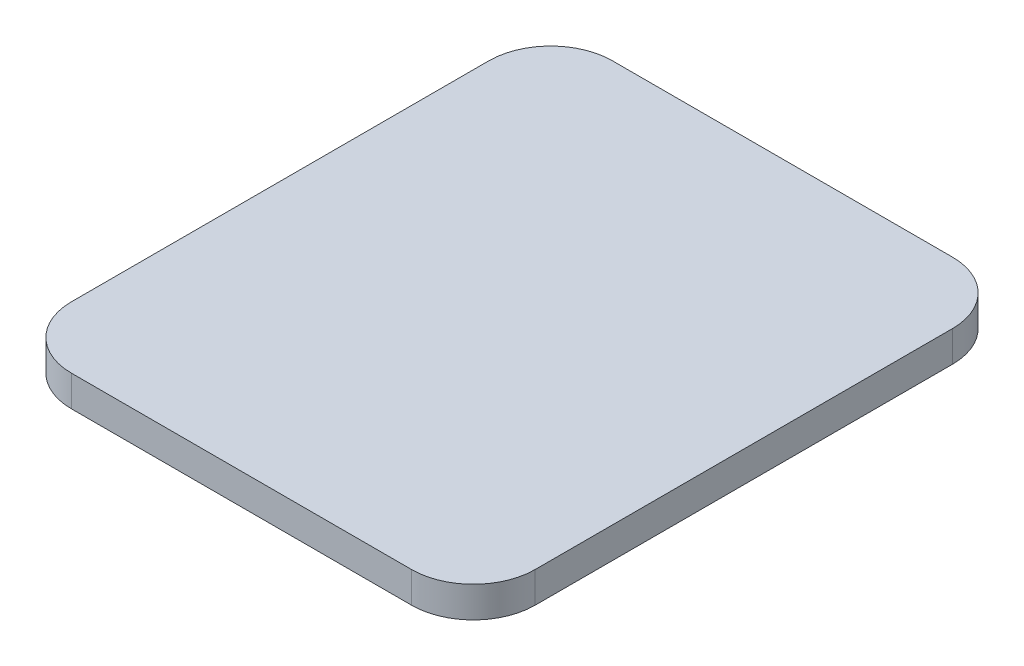
from build123d import *

# Parameters (mm, degrees)
EXTRUDE_343_DEPTH = 2


with BuildPart() as part:
    # Sketch 179 → Extrude 343 (new body)
    with BuildSketch(Plane(origin=(0, 0, 0), x_dir=(1, 0, 0), z_dir=(0, 1, 0))):
        with BuildLine():
            Line((-11, 17.5), (11, 17.5))
            ThreePointArc((11, 17.5), (13.828427125, 16.328427125), (15, 13.5))
            Line((15, 13.5), (15, -13.5))
            ThreePointArc((15, -13.5), (13.828427125, -16.328427125), (11, -17.5))
            Line((11, -17.5), (-11, -17.5))
            ThreePointArc((-11, -17.5), (-13.828427125, -16.328427125), (-15, -13.5))
            Line((-15, -13.5), (-15, 13.5))
            ThreePointArc((-15, 13.5), (-13.828427125, 16.328427125), (-11, 17.5))
        make_face()
    extrude(amount=-EXTRUDE_343_DEPTH)


solid = part.part
